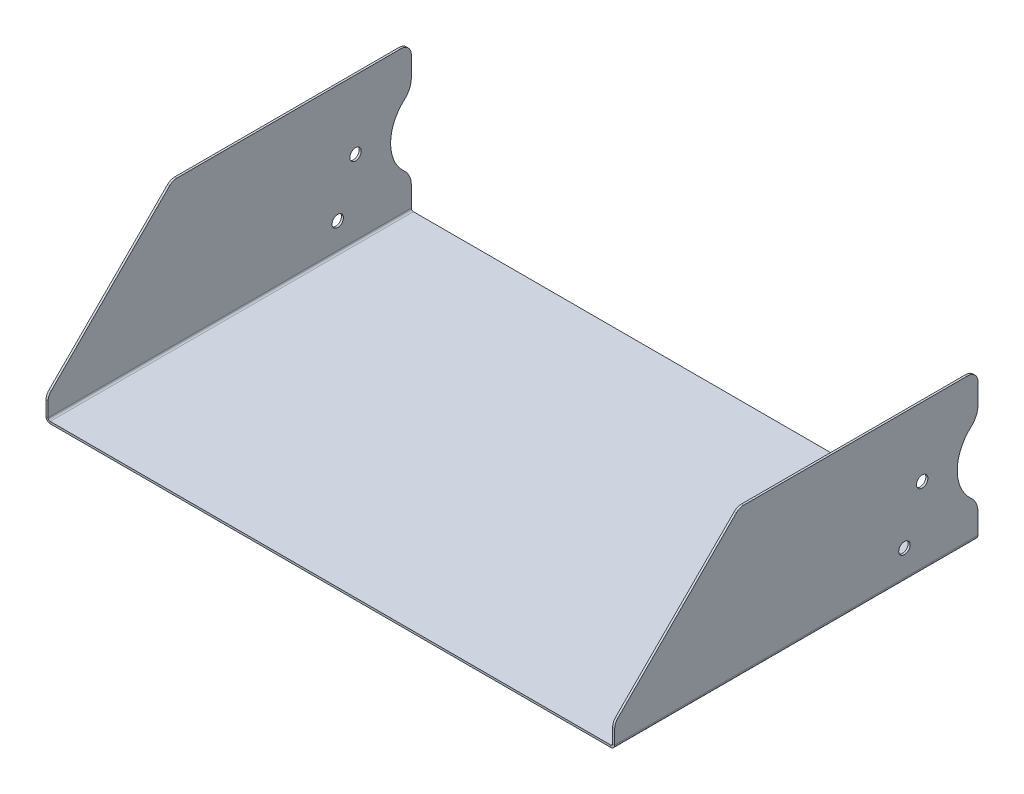
from build123d import *

# Parameters (mm, degrees)
TABAN_FLAN_1_DEPTH    = 350
PAH1_SIZE             = 120
IZIM2_R               = 5.5
KES_EKSTR_ZYON1_DEPTH = 614
RADYUS1_R             = 10
RADYUS2_R             = 10
IZIM3_R               = 40
KES_EKSTR_ZYON2_DEPTH = 647
RADYUS3_R             = 20


# Sheet-metal steps are written as plain solids
with BuildPart() as part:
    # Çizim1 → Taban-Flanş1 (new body)
    with BuildSketch(Plane.XY):
        with BuildLine():
            Line((0, 0), (0, -138))
            ThreePointArc((0, -138), (0.585786438, -139.414213562), (2, -140))
            Line((2, -140), (542, -140))
            ThreePointArc((542, -140), (543.414213562, -139.414213562), (544, -138))
            Line((544, -138), (544, 0))
            Line((544, 0), (546, 0))
            Line((546, 0), (546, -138))
            ThreePointArc((546, -138), (544.828427125, -140.828427125), (542, -142))
            Line((542, -142), (2, -142))
            ThreePointArc((2, -142), (-0.828427125, -140.828427125), (-2, -138))
            Line((-2, -138), (-2, 0))
            Line((-2, 0), (0, 0))
        make_face()
    extrude(amount=-TABAN_FLAN_1_DEPTH)

    # Pah1
    pah1_edges = [part.edges().sort_by_distance(p)[0] for p in [
        (-1, 0, 0),
        (545, 0, 0),
    ]]
    chamfer(pah1_edges, length=PAH1_SIZE)

    # Çizim2 → Kes-Ekstrüzyon1 (cut)
    with BuildSketch(Plane.ZY.offset(2)):
        with Locations(Location((-279.118209744, -113.241831987, 0), (0, 0, 180))):
            Circle(IZIM2_R)
        with Locations(Location((-296.219216911, -66.257200948, 0), (0, 0, 180))):
            Circle(IZIM2_R)
    extrude(amount=-KES_EKSTR_ZYON1_DEPTH, mode=Mode.SUBTRACT)

    # Radyus1
    radyus1_edges = [part.edges().sort_by_distance(p)[0] for p in [
        (-1, 0, -350),
        (545, 0, -120),
        (-1, 0, -120),
        (545, 0, -350),
    ]]
    fillet(radyus1_edges, radius=RADYUS1_R)

    # Radyus2
    radyus2_edges = [part.edges().sort_by_distance(p)[0] for p in [
        (545, -120, 0),
        (-1, -120, 0),
    ]]
    fillet(radyus2_edges, radius=RADYUS2_R)

    # Çizim3 → Kes-Ekstrüzyon2 (cut)
    with BuildSketch(Plane.ZY.offset(2)):
        with Locations((-370, -74)):
            Circle(IZIM3_R)
    extrude(amount=-KES_EKSTR_ZYON2_DEPTH, mode=Mode.SUBTRACT)

    # Radyus3
    radyus3_edges = [part.edges().sort_by_distance(p)[0] for p in [
        (545, -39.358983849, -350),
        (545, -108.641016151, -350),
        (-1, -108.641016151, -350),
        (-1, -39.358983849, -350),
    ]]
    fillet(radyus3_edges, radius=RADYUS3_R)


solid = part.part
